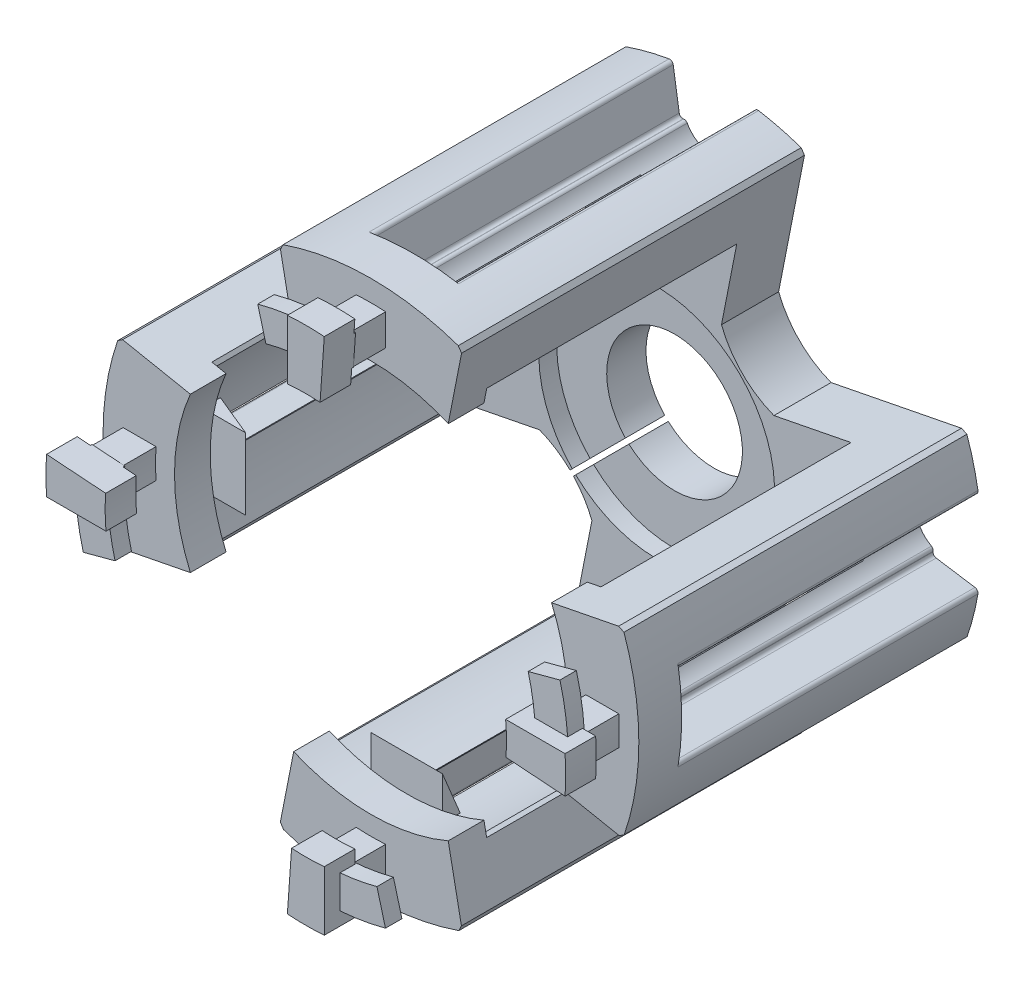
from build123d import *

# Parameters (mm, degrees)
SKETCH13_R                         = 1.7
CUT_EXTRUDE2_DEPTH                 = 72.529714105
CUT_EXTRUDE3_START                 = -6
SKETCH15_R                         = 3.25
CUT_EXTRUDE3_DEPTH                 = 66.529714105
CUT_EXTRUDE7_DEPTH                 = 72.529714105
SKETCH22_R                         = 9.5
CUT_EXTRUDE9_DEPTH                 = 8
CORTAR_EXTRUIR2_DEPTH              = 5
CHAFL_N1_SIZE                      = 0.424494443
CHAFL_N1_SIZE_2                    = 0.598474752
CHAFL_N1_SIZE_3                    = 0.5
SALIENTE_EXTRUIR4_START            = -4
SALIENTE_EXTRUIR4_DEPTH            = 6
CORTAR_EXTRUIR10_REACH             = 60.63
CORTAR_EXTRUIR10_DIRECTION_2_REACH = 60.63
CROQUIS29_R                        = 4.25
CORTAR_EXTRUIR11_DEPTH             = 42
REDONDEO2_R                        = 0.5
CORTAR_EXTRUIR14_REACH             = 73.53
CORTAR_EXTRUIR14_DIRECTION_2_REACH = 73.53
CORTAR_EXTRUIR15_REACH             = 73.53
CORTAR_EXTRUIR15_DIRECTION_2_REACH = 73.53
CORTAR_EXTRUIR17_DEPTH             = 2.523438
CORTAR_EXTRUIR17_DEPTH_BACK        = 2
CROQUIS40_R                        = 29
SCALE1_SCALE                       = 2.1714285
CUT_EXTRUDE10_DEPTH                = 23
SKETCH27_R                         = 4.590920363
SKETCH27_R_2                       = 4.507016233
SKETCH27_R_3                       = 5.572824569
SKETCH27_R_4                       = 4.546487361
BOSS_EXTRUDE1_DEPTH                = 13.028571
BOSS_EXTRUDE2_DEPTH                = 10
BOSS_EXTRUDE3_DEPTH                = 5
BOSS_EXTRUDE4_START                = -4.5
BOSS_EXTRUDE4_DEPTH                = 9.3
CUT_EXTRUDE12_START                = 10
SKETCH31_R                         = 89.186650453
CUT_EXTRUDE12_DEPTH                = 10
CUT_EXTRUDE15_DEPTH                = 10
CUT_EXTRUDE16_START                = -10
CUT_EXTRUDE16_DEPTH                = 10
CUT_EXTRUDE17_DEPTH                = 15
SKETCH35_R                         = 65.478901107
CUT_EXTRUDE18_DEPTH                = 0.5
CUT_EXTRUDE19_DEPTH                = 11
CIRPATTERN1_COUNT                  = 4
CUT_EXTRUDE20_DEPTH                = 11


with BuildPart() as part:
    # Sketch1 → Revolve1 (revolve)
    with BuildSketch(Plane(origin=(0, 0, 0), x_dir=(1, 0, 0), z_dir=(0, 1, 0))):
        Polygon((37.5, -48), (0, -48), (0, -45.5), (11.5, -45.5), (11.5, -43), (13, -43), (13, -45.5), (16.5, -45.5), (16.5, -43), (29, -43), (29, -8), (16.5, -8), (16.5, -5.5), (0, -5.5), (0, 0), (37.5, 0), align=None)
    revolve(axis=Axis((0, 0, 48), (0, 0, -1)))

    # Sketch13 → Cut-Extrude2 (cut, through all)
    with BuildSketch(Plane.XY.offset(48)):
        with Locations((0, -32.5)):
            Circle(SKETCH13_R)
        with Locations((-32.5, 0)):
            Circle(SKETCH13_R)
        with Locations((0, 32.5)):
            Circle(SKETCH13_R)
        with Locations((32.5, 0)):
            Circle(SKETCH13_R)
    cut_extrude2 = extrude(amount=-CUT_EXTRUDE2_DEPTH, mode=Mode.SUBTRACT)

    # Sketch15 → Cut-Extrude3 (cut, through all)
    with BuildSketch(Plane.XY.offset(48).offset(CUT_EXTRUDE3_START)):
        with Locations((32.5, 0)):
            Circle(SKETCH15_R)
        with Locations((0, 32.5)):
            Circle(SKETCH15_R)
        with Locations((-32.5, 0)):
            Circle(SKETCH15_R)
    cut_extrude3 = extrude(amount=-CUT_EXTRUDE3_DEPTH, mode=Mode.SUBTRACT)

    # Sketch19 → Cut-Extrude7 (cut, through all)
    with BuildSketch(Plane.XY):
        with BuildLine():
            Line((-35.254963314, 12.780358437), (-16.410016137, 9.07049449))
            ThreePointArc((-16.410016137, 9.07049449), (-11.965806565, 11.965806548), (-9.070494507, 16.41001612))
            Line((-9.070494507, 16.41001612), (-12.780358457, 35.254963298))
            ThreePointArc((-12.780358457, 35.254963298), (-26.516504301, 26.516504282), (-35.254963314, 12.780358437))
        make_face()
        with BuildLine():
            Line((12.780358458, 35.254963298), (9.070494508, 16.410016121))
            ThreePointArc((9.070494508, 16.410016121), (11.964662982, 11.964662966), (16.410016137, 9.07049449))
            Line((16.410016137, 9.07049449), (35.254963314, 12.780358437))
            ThreePointArc((35.254963314, 12.780358437), (26.516504301, 26.516504282), (12.780358458, 35.254963298))
        make_face()
    cut_extrude7 = extrude(amount=CUT_EXTRUDE7_DEPTH, mode=Mode.SUBTRACT)

    # Sketch22 → Cut-Extrude9 (cut)
    with BuildSketch(Plane.XY):
        Circle(SKETCH22_R)
    extrude(amount=CUT_EXTRUDE9_DEPTH, mode=Mode.SUBTRACT)

    # Simetría1: Cut-Extrude2, Cut-Extrude3, Cut-Extrude7 across plane
    add(cut_extrude2.mirror(Plane.ZX), mode=Mode.SUBTRACT)
    add(cut_extrude3.mirror(Plane.ZX), mode=Mode.SUBTRACT)
    add(cut_extrude7.mirror(Plane.ZX), mode=Mode.SUBTRACT)

    # Croquis2 → Cortar-Extruir2 (cut)
    with BuildSketch(Plane.XY.offset(48)):
        with BuildLine():
            ThreePointArc((27.500000001, 0), (0, 27.500000001), (-27.500000001, 0))
            ThreePointArc((-27.500000001, 0), (0, -27.500000001), (27.500000001, 0))
        make_face()
    extrude(amount=-CORTAR_EXTRUIR2_DEPTH, mode=Mode.SUBTRACT)

    # Chaflán1
    # the kernel refuses this chamfer: 0.598474752, 0.598474751, 0.5, 0.424494443 mm, written as the material it takes off along each edge
    with BuildSketch(Plane(origin=(26.786144822, 11.113165417, 43), x_dir=(0.9811682057533571, 0.19315525366589945, 0), z_dir=(0, 0, -1)), Plane(origin=(-26.786144822, -11.113165417, 43), x_dir=(-0.9811682057533575, -0.1931552536658979, 0), z_dir=(0, 0, -1)), Plane(origin=(11.113165438, -26.786144813, 43), x_dir=(0.19315525383159873, -0.9811682057207372, 0), z_dir=(0, 0, -1)), Plane(origin=(-11.113165438, 26.786144813, 43), x_dir=(-0.19315525383159932, 0.9811682057207369, 0), z_dir=(0, 0, -1))) as chafl_n1_piece_1:
        with BuildLine():
            Line((CHAFL_N1_SIZE, 0), (0.095359683, 0.495309657))
            ThreePointArc((0.095359683, 0.495309657), (0.050104646, 0.254453298), (0, 0))
            Line((0, 0), (CHAFL_N1_SIZE, 0))
        make_face()
    extrude(amount=35, mode=Mode.SUBTRACT)
    with BuildSketch(Plane(origin=(35.254963314, 12.780358437, -1.544879383), x_dir=(-0.9811682057533563, -0.19315525366590316, 0), z_dir=(0, 0, 1)), Plane(origin=(-35.254963314, -12.780358437, -1.544879383), x_dir=(0.9811682057533574, 0.19315525366589809, 0), z_dir=(0, 0, 1))) as chafl_n1_piece_2:
        with BuildLine():
            Line((CHAFL_N1_SIZE_2 * 0.999999998655, 0), (-0.072646196, 0.491380113))
            ThreePointArc((-0.072646196, 0.491380113), (-0.038365123, 0.253885272), (0, 0))
            Line((0, 0), (CHAFL_N1_SIZE_2 * 0.999999998655, 0))
        make_face()
    extrude(amount=51.089758766, mode=Mode.SUBTRACT)
    with BuildSketch(Plane(origin=(11.113165438, 26.786144813, 43), x_dir=(0.1931552538316015, 0.9811682057207366, 0), z_dir=(0, 0, -1)), Plane(origin=(-11.113165438, -26.786144813, 43), x_dir=(-0.19315525383160223, -0.9811682057207365, 0), z_dir=(0, 0, -1))) as chafl_n1_piece_3:
        with BuildLine():
            Line((CHAFL_N1_SIZE_3, 0), (0.081210474, -0.418789526))
            ThreePointArc((0.081210474, -0.418789526), (0.042440346, -0.214740554), (0, 0))
            Line((0, 0), (CHAFL_N1_SIZE_3, 0))
        make_face()
    extrude(amount=35, mode=Mode.SUBTRACT)
    with BuildSketch(Plane(origin=(12.780358458, 35.254963298, -1.528696863), x_dir=(-0.9427936694499047, 0.3333768090992289, 0), z_dir=(0, 0, 1)), Plane(origin=(-12.780358457, -35.254963298, -1.528696863), x_dir=(0.9427936694512155, -0.33337680909552225, 0), z_dir=(0, 0, 1))) as chafl_n1_piece_4:
        with BuildLine():
            Line((0.592108744, 0), (-CHAFL_N1_SIZE_3 * 0.144993175079, CHAFL_N1_SIZE_3 * 0.989432655202))
            Line((-CHAFL_N1_SIZE_3 * 0.144993175079, CHAFL_N1_SIZE_3 * 0.989432655202), (0, 0))
            ThreePointArc((0, 0), (0.305654294, -0.001167436), (0.592108744, 0))
        make_face()
    extrude(amount=51.057393726, mode=Mode.SUBTRACT)
    with BuildSketch(Plane(origin=(12.780358458, -35.254963298, -1.544879384), x_dir=(-0.19315525383160725, 0.9811682057207355, 0), z_dir=(0, 0, 1)), Plane(origin=(-12.780358457, 35.254963298, -1.544879384), x_dir=(0.19315525383159907, -0.9811682057207369, 0), z_dir=(0, 0, 1))) as chafl_n1_piece_5:
        with BuildLine():
            Line((CHAFL_N1_SIZE_2, 0), (-0.072646206, 0.491380121))
            ThreePointArc((-0.072646206, 0.491380121), (-0.038365133, 0.253885275), (0, 0))
            Line((0, 0), (CHAFL_N1_SIZE_2, 0))
        make_face()
    extrude(amount=51.089758768, mode=Mode.SUBTRACT)
    with BuildSketch(Plane(origin=(26.786144822, -11.113165417, 43), x_dir=(0.9811682057533571, -0.19315525366590003, 0), z_dir=(0, 0, -1)), Plane(origin=(-26.786144822, 11.113165417, 43), x_dir=(-0.9811682057533571, 0.19315525366590003, 0), z_dir=(0, 0, -1))) as chafl_n1_piece_6:
        with BuildLine():
            Line((CHAFL_N1_SIZE_3, 0), (0.081210473, -0.418789527))
            ThreePointArc((0.081210473, -0.418789527), (0.042440346, -0.214740554), (0, 0))
            Line((0, 0), (CHAFL_N1_SIZE_3, 0))
        make_face()
    extrude(amount=35, mode=Mode.SUBTRACT)
    with BuildSketch(Plane(origin=(35.254963314, -12.780358437, -1.528696832), x_dir=(0.33337679452852365, 0.9427936746021829, 0), z_dir=(0, 0, 1))) as chafl_n1_piece_7:
        with BuildLine():
            Line((0.592108732, 0), (-CHAFL_N1_SIZE_3 * 0.144993159955, CHAFL_N1_SIZE_3 * 0.989432657419))
            Line((-CHAFL_N1_SIZE_3 * 0.144993159955, CHAFL_N1_SIZE_3 * 0.989432657419), (0, 0))
            ThreePointArc((0, 0), (0.305654288, -0.001167431), (0.592108732, 0))
        make_face()
    extrude(amount=51.057393665, mode=Mode.SUBTRACT)
    with BuildSketch(Plane(origin=(-35.254963314, 12.780358437, -1.528696832), x_dir=(0.9811682057533581, -0.19315525366589525, 0), z_dir=(0, 0, 1))) as chafl_n1_piece_8:
        with BuildLine():
            Line((CHAFL_N1_SIZE_3, 0), (-0.085851716, -0.585851716))
            ThreePointArc((-0.085851716, -0.585851716), (-0.045472876, -0.302255064), (0, 0))
            Line((0, 0), (CHAFL_N1_SIZE_3, 0))
        make_face()
    extrude(amount=51.057393665, mode=Mode.SUBTRACT)

    # Croquis28 → Saliente-Extruir4 (add)
    with BuildSketch(Plane.XY.offset(41).offset(SALIENTE_EXTRUIR4_START)):
        Polygon((-5, 29.5), (-5, 22.5), (5, 22.5), (5, 29.5), (0, 29.5), align=None)
        Polygon((-5, -29.5), (-5, -22.5), (5, -22.5), (5, -29.5), (0, -29.5), align=None)
        Polygon((-29.5, 0), (-29.5, 5), (-22.500000001, 5), (-22.500000001, -5), (-29.5, -5), align=None)
        Polygon((29.5, 0), (29.5, 5), (22.5, 5), (22.5, -5), (29.5, -5), align=None)
    extrude(amount=SALIENTE_EXTRUIR4_DEPTH)

    # Cortar-Extruir10: up to this face of the body (flat: up to its plane)
    cortar_extruir10_end = Plane(part.part.faces().sort_by_distance((2.629134616, 30.747243589, 42))[0])
    # Croquis1 → Cortar-Extruir10 (cut, up to the picked face)
    with BuildSketch(Plane(origin=(0, 0, 25), x_dir=(-1, 0, 0), z_dir=(0, 0, -1)), mode=Mode.PRIVATE) as cortar_extruir10_sk1:
        with BuildLine():
            Line((4.769230769, 30.630939226), (5.769230769, 37.053555515))
            ThreePointArc((5.769230769, 37.053555515), (0, 37.5), (-5.769230769, 37.053555515))
            Line((-5.769230769, 37.053555515), (-4.769230769, 30.630939226))
            ThreePointArc((-4.769230769, 30.630939226), (0, 31), (4.769230769, 30.630939226))
        make_face()
    cortar_extruir10_tool1 = split(extrude(cortar_extruir10_sk1.sketch, amount=-CORTAR_EXTRUIR10_REACH, mode=Mode.PRIVATE), bisect_by=cortar_extruir10_end, keep=Keep.BOTH, mode=Mode.PRIVATE)
    # Croquis1 → Cortar-Extruir10 (cut, up to the picked face)
    with BuildSketch(Plane(origin=(0, 0, 25), x_dir=(-1, 0, 0), z_dir=(0, 0, -1)), mode=Mode.PRIVATE) as cortar_extruir10_sk2:
        with BuildLine():
            Line((-37.053555515, 5.769230769), (-30.630939226, 4.769230769))
            ThreePointArc((-30.630939226, 4.769230769), (-31, 0), (-30.630939226, -4.769230769))
            Line((-30.630939226, -4.769230769), (-37.053555515, -5.769230769))
            ThreePointArc((-37.053555515, -5.769230769), (-37.5, 0), (-37.053555515, 5.769230769))
        make_face()
    cortar_extruir10_tool2 = split(extrude(cortar_extruir10_sk2.sketch, amount=-CORTAR_EXTRUIR10_REACH, mode=Mode.PRIVATE), bisect_by=cortar_extruir10_end, keep=Keep.BOTH, mode=Mode.PRIVATE)
    # Croquis1 → Cortar-Extruir10 (cut, up to the picked face)
    with BuildSketch(Plane(origin=(0, 0, 25), x_dir=(-1, 0, 0), z_dir=(0, 0, -1)), mode=Mode.PRIVATE) as cortar_extruir10_sk3:
        with BuildLine():
            Line((-5.769230769, -37.053555515), (-4.769230769, -30.630939226))
            ThreePointArc((-4.769230769, -30.630939226), (0, -31), (4.769230769, -30.630939226))
            Line((4.769230769, -30.630939226), (5.769230769, -37.053555515))
            ThreePointArc((5.769230769, -37.053555515), (0, -37.5), (-5.769230769, -37.053555515))
        make_face()
    cortar_extruir10_tool3 = split(extrude(cortar_extruir10_sk3.sketch, amount=-CORTAR_EXTRUIR10_REACH, mode=Mode.PRIVATE), bisect_by=cortar_extruir10_end, keep=Keep.BOTH, mode=Mode.PRIVATE)
    # Croquis1 → Cortar-Extruir10 (cut, up to the picked face)
    with BuildSketch(Plane(origin=(0, 0, 25), x_dir=(-1, 0, 0), z_dir=(0, 0, -1)), mode=Mode.PRIVATE) as cortar_extruir10_sk4:
        with BuildLine():
            Line((30.630939226, -4.769230769), (37.053555515, -5.769230769))
            ThreePointArc((37.053555515, -5.769230769), (37.5, 0), (37.053555515, 5.769230769))
            Line((37.053555515, 5.769230769), (30.630939226, 4.769230769))
            ThreePointArc((30.630939226, 4.769230769), (31, 0), (30.630939226, -4.769230769))
        make_face()
    cortar_extruir10_tool4 = split(extrude(cortar_extruir10_sk4.sketch, amount=-CORTAR_EXTRUIR10_REACH, mode=Mode.PRIVATE), bisect_by=cortar_extruir10_end, keep=Keep.BOTH, mode=Mode.PRIVATE)
    add(cortar_extruir10_tool1.solids().sort_by(Axis((0, 34.216364, 25), (0, 0, 1)))[0], mode=Mode.SUBTRACT)
    add(cortar_extruir10_tool2.solids().sort_by(Axis((34.216364, 0, 25), (0, 0, 1)))[0], mode=Mode.SUBTRACT)
    add(cortar_extruir10_tool3.solids().sort_by(Axis((0, -34.216364, 25), (0, 0, 1)))[0], mode=Mode.SUBTRACT)
    add(cortar_extruir10_tool4.solids().sort_by(Axis((-34.216364, 0, 25), (0, 0, 1)))[0], mode=Mode.SUBTRACT)

    # Cortar-Extruir10 direction 2: up to this face of the body (flat: up to its plane)
    cortar_extruir10_direction_2_end = Plane(part.part.faces().sort_by_distance((-25.792069759, 9.836451612, 0))[0])
    # Croquis1 → Cortar-Extruir10 direction 2 (cut, up to the picked face)
    with BuildSketch(Plane(origin=(0, 0, 25), x_dir=(-1, 0, 0), z_dir=(0, 0, -1)), mode=Mode.PRIVATE) as cortar_extruir10_direction_2_sk1:
        with BuildLine():
            Line((4.769230769, 30.630939226), (5.769230769, 37.053555515))
            ThreePointArc((5.769230769, 37.053555515), (0, 37.5), (-5.769230769, 37.053555515))
            Line((-5.769230769, 37.053555515), (-4.769230769, 30.630939226))
            ThreePointArc((-4.769230769, 30.630939226), (0, 31), (4.769230769, 30.630939226))
        make_face()
    cortar_extruir10_direction_2_tool1 = split(extrude(cortar_extruir10_direction_2_sk1.sketch, amount=CORTAR_EXTRUIR10_DIRECTION_2_REACH, mode=Mode.PRIVATE), bisect_by=cortar_extruir10_direction_2_end, keep=Keep.BOTH, mode=Mode.PRIVATE)
    # Croquis1 → Cortar-Extruir10 direction 2 (cut, up to the picked face)
    with BuildSketch(Plane(origin=(0, 0, 25), x_dir=(-1, 0, 0), z_dir=(0, 0, -1)), mode=Mode.PRIVATE) as cortar_extruir10_direction_2_sk2:
        with BuildLine():
            Line((-37.053555515, 5.769230769), (-30.630939226, 4.769230769))
            ThreePointArc((-30.630939226, 4.769230769), (-31, 0), (-30.630939226, -4.769230769))
            Line((-30.630939226, -4.769230769), (-37.053555515, -5.769230769))
            ThreePointArc((-37.053555515, -5.769230769), (-37.5, 0), (-37.053555515, 5.769230769))
        make_face()
    cortar_extruir10_direction_2_tool2 = split(extrude(cortar_extruir10_direction_2_sk2.sketch, amount=CORTAR_EXTRUIR10_DIRECTION_2_REACH, mode=Mode.PRIVATE), bisect_by=cortar_extruir10_direction_2_end, keep=Keep.BOTH, mode=Mode.PRIVATE)
    # Croquis1 → Cortar-Extruir10 direction 2 (cut, up to the picked face)
    with BuildSketch(Plane(origin=(0, 0, 25), x_dir=(-1, 0, 0), z_dir=(0, 0, -1)), mode=Mode.PRIVATE) as cortar_extruir10_direction_2_sk3:
        with BuildLine():
            Line((-5.769230769, -37.053555515), (-4.769230769, -30.630939226))
            ThreePointArc((-4.769230769, -30.630939226), (0, -31), (4.769230769, -30.630939226))
            Line((4.769230769, -30.630939226), (5.769230769, -37.053555515))
            ThreePointArc((5.769230769, -37.053555515), (0, -37.5), (-5.769230769, -37.053555515))
        make_face()
    cortar_extruir10_direction_2_tool3 = split(extrude(cortar_extruir10_direction_2_sk3.sketch, amount=CORTAR_EXTRUIR10_DIRECTION_2_REACH, mode=Mode.PRIVATE), bisect_by=cortar_extruir10_direction_2_end, keep=Keep.BOTH, mode=Mode.PRIVATE)
    # Croquis1 → Cortar-Extruir10 direction 2 (cut, up to the picked face)
    with BuildSketch(Plane(origin=(0, 0, 25), x_dir=(-1, 0, 0), z_dir=(0, 0, -1)), mode=Mode.PRIVATE) as cortar_extruir10_direction_2_sk4:
        with BuildLine():
            Line((30.630939226, -4.769230769), (37.053555515, -5.769230769))
            ThreePointArc((37.053555515, -5.769230769), (37.5, 0), (37.053555515, 5.769230769))
            Line((37.053555515, 5.769230769), (30.630939226, 4.769230769))
            ThreePointArc((30.630939226, 4.769230769), (31, 0), (30.630939226, -4.769230769))
        make_face()
    cortar_extruir10_direction_2_tool4 = split(extrude(cortar_extruir10_direction_2_sk4.sketch, amount=CORTAR_EXTRUIR10_DIRECTION_2_REACH, mode=Mode.PRIVATE), bisect_by=cortar_extruir10_direction_2_end, keep=Keep.BOTH, mode=Mode.PRIVATE)
    add(cortar_extruir10_direction_2_tool1.solids().sort_by(Axis((0, 34.216364, 25), (0, 0, -1)))[0], mode=Mode.SUBTRACT)
    add(cortar_extruir10_direction_2_tool2.solids().sort_by(Axis((34.216364, 0, 25), (0, 0, -1)))[0], mode=Mode.SUBTRACT)
    add(cortar_extruir10_direction_2_tool3.solids().sort_by(Axis((0, -34.216364, 25), (0, 0, -1)))[0], mode=Mode.SUBTRACT)
    add(cortar_extruir10_direction_2_tool4.solids().sort_by(Axis((-34.216364, 0, 25), (0, 0, -1)))[0], mode=Mode.SUBTRACT)

    # Croquis29 → Cortar-Extruir11 (cut)
    with BuildSketch(Plane.XY):
        with Locations((0, -32.5)):
            Circle(CROQUIS29_R)
        with Locations((0, 32.5)):
            Circle(CROQUIS29_R)
        with Locations((32.5, 0)):
            Circle(CROQUIS29_R)
        with Locations((-32.5, 0)):
            Circle(CROQUIS29_R)
    extrude(amount=CORTAR_EXTRUIR11_DEPTH, mode=Mode.SUBTRACT)

    # Redondeo2
    redondeo2_edges = [part.edges().sort_by_distance(p)[0] for p in [
        (-4.769230769, 30.630939226, 21),
        (4.769230769, 30.630939226, 21),
        (-5.769230769, 37.053555515, 21),
        (5.769230769, 37.053555515, 21),
        (30.630939226, 4.769230769, 21),
        (30.630939226, -4.769230769, 21),
        (37.053555515, 5.769230769, 21),
        (37.053555515, -5.769230769, 21),
        (-4.769230769, -30.630939226, 21),
        (4.769230769, -30.630939226, 21),
        (5.769230769, -37.053555515, 21),
        (-5.769230769, -37.053555515, 21),
        (-30.630939226, -4.769230769, 21),
        (-37.053555515, -5.769230769, 21),
        (-37.053555515, 5.769230769, 21),
        (-30.630939226, 4.769230769, 21),
        (-30.756730769, -3.876017594, 21),
        (-3.876017594, 30.756730769, 21),
        (30.756730769, 3.876017594, 21),
        (3.876017594, -30.756730769, 21),
        (-3.876017594, -30.756730769, 21),
        (3.876017594, 30.756730769, 21),
        (30.756730769, -3.876017594, 21),
        (-30.756730769, 3.876017594, 21),
    ]]
    fillet(redondeo2_edges, radius=REDONDEO2_R)

    # Cortar-Extruir14: up to this face of the body (flat: up to its plane)
    cortar_extruir14_end = Plane(part.part.faces().sort_by_distance((-25.532856857, -5, 40))[0])
    # Croquis35 → Cortar-Extruir14 (cut, up to the picked face)
    with BuildSketch(Plane(origin=(0, 0, 0), x_dir=(1, 0, 0), z_dir=(0, 1, 0)), mode=Mode.PRIVATE) as cortar_extruir14_sk1:
        Polygon((-28.525380373, -37), (-22.500000001, -37), (-22.500000001, -43.019491245), (-28.525380373, -40.52), align=None)
    cortar_extruir14_tool1 = split(extrude(cortar_extruir14_sk1.sketch, amount=-CORTAR_EXTRUIR14_REACH, mode=Mode.PRIVATE), bisect_by=cortar_extruir14_end, keep=Keep.BOTH, mode=Mode.PRIVATE)
    cortar_extruir14 = cortar_extruir14_tool1.solids().sort_by(Axis((-25.249567, 0, 39.439448), (0, -1, 0)))[0]
    add(cortar_extruir14, mode=Mode.SUBTRACT)

    # Cortar-Extruir14 direction 2: up to this face of the body (flat: up to its plane)
    cortar_extruir14_direction_2_end = Plane(part.part.faces().sort_by_distance((-25.532856857, 5, 40))[0])
    # Croquis35 → Cortar-Extruir14 direction 2 (cut, up to the picked face)
    with BuildSketch(Plane(origin=(0, 0, 0), x_dir=(1, 0, 0), z_dir=(0, 1, 0)), mode=Mode.PRIVATE) as cortar_extruir14_direction_2_sk1:
        Polygon((-28.525380373, -37), (-22.500000001, -37), (-22.500000001, -43.019491245), (-28.525380373, -40.52), align=None)
    cortar_extruir14_direction_2_tool1 = split(extrude(cortar_extruir14_direction_2_sk1.sketch, amount=CORTAR_EXTRUIR14_DIRECTION_2_REACH, mode=Mode.PRIVATE), bisect_by=cortar_extruir14_direction_2_end, keep=Keep.BOTH, mode=Mode.PRIVATE)
    cortar_extruir14_direction_2 = cortar_extruir14_direction_2_tool1.solids().sort_by(Axis((-25.249567, 0, 39.439448), (0, 1, 0)))[0]
    add(cortar_extruir14_direction_2, mode=Mode.SUBTRACT)

    # Simetría2: Cortar-Extruir14, Cortar-Extruir14 direction 2 across plane
    add(cortar_extruir14.mirror(Plane(origin=(0, 0, 0), x_dir=(0, 0, 1), z_dir=(1, 0, 0))), mode=Mode.SUBTRACT)
    add(cortar_extruir14_direction_2.mirror(Plane(origin=(0, 0, 0), x_dir=(0, 0, 1), z_dir=(1, 0, 0))), mode=Mode.SUBTRACT)

    # Cortar-Extruir15: up to this face of the body (flat: up to its plane)
    cortar_extruir15_end = Plane(part.part.faces().sort_by_distance((5, -25.532856857, 40))[0])
    # Croquis37 → Cortar-Extruir15 (cut, up to the picked face)
    with BuildSketch(Plane(origin=(0, 0, 0), x_dir=(0, 0, -1), z_dir=(1, 0, 0)), mode=Mode.PRIVATE) as cortar_extruir15_sk1:
        Polygon((-40.523437886, -28.525380365), (-43.023437886, -22.499993195), (-35.023437886, -22.499993195), (-35.023437886, -28.525380365), align=None)
    cortar_extruir15_tool1 = split(extrude(cortar_extruir15_sk1.sketch, amount=CORTAR_EXTRUIR15_REACH, mode=Mode.PRIVATE), bisect_by=cortar_extruir15_end, keep=Keep.BOTH, mode=Mode.PRIVATE)
    cortar_extruir15 = cortar_extruir15_tool1.solids().sort_by(Axis((0, -25.326718, 38.437018), (1, 0, 0)))[0]
    add(cortar_extruir15, mode=Mode.SUBTRACT)

    # Cortar-Extruir15 direction 2: up to this face of the body (flat: up to its plane)
    cortar_extruir15_direction_2_end = Plane(part.part.faces().sort_by_distance((-5, -25.532856857, 40))[0])
    # Croquis37 → Cortar-Extruir15 direction 2 (cut, up to the picked face)
    with BuildSketch(Plane(origin=(0, 0, 0), x_dir=(0, 0, -1), z_dir=(1, 0, 0)), mode=Mode.PRIVATE) as cortar_extruir15_direction_2_sk1:
        Polygon((-40.523437886, -28.525380365), (-43.023437886, -22.499993195), (-35.023437886, -22.499993195), (-35.023437886, -28.525380365), align=None)
    cortar_extruir15_direction_2_tool1 = split(extrude(cortar_extruir15_direction_2_sk1.sketch, amount=-CORTAR_EXTRUIR15_DIRECTION_2_REACH, mode=Mode.PRIVATE), bisect_by=cortar_extruir15_direction_2_end, keep=Keep.BOTH, mode=Mode.PRIVATE)
    cortar_extruir15_direction_2 = cortar_extruir15_direction_2_tool1.solids().sort_by(Axis((0, -25.326718, 38.437018), (-1, 0, 0)))[0]
    add(cortar_extruir15_direction_2, mode=Mode.SUBTRACT)

    # Simetría3: Cortar-Extruir15, Cortar-Extruir15 direction 2 across plane
    add(cortar_extruir15.mirror(Plane.ZX), mode=Mode.SUBTRACT)
    add(cortar_extruir15_direction_2.mirror(Plane.ZX), mode=Mode.SUBTRACT)

    # Croquis40 → Cortar-Extruir17 (cut, two sides: drawn at the far end of the back side and taken through both)
    with BuildSketch(Plane.XY.offset(38).offset(-CORTAR_EXTRUIR17_DEPTH_BACK)):
        Circle(CROQUIS40_R)
    extrude(amount=CORTAR_EXTRUIR17_DEPTH + CORTAR_EXTRUIR17_DEPTH_BACK, mode=Mode.SUBTRACT)


with BuildPart() as part_1:
    # Scale1: scaled about (-5.8101e-05, 0, 19.382301169)
    add(part.part.scale(SCALE1_SCALE).moved(Location((6.8061e-05, 0, -22.704979985))))

    # Sketch26 → Cut-Extrude10 (cut)
    with BuildSketch(Plane(origin=(0, 0, -22.704980025), x_dir=(-1, 0, 0), z_dir=(0, 0, -1))):
        Polygon((-0.707106781, -0.707106781), (0.353553391, 0.353553391), (43.744234901, -43.03712812), (42.68357473, -44.097788292), align=None)
    extrude(amount=-CUT_EXTRUDE10_DEPTH, mode=Mode.SUBTRACT)

    # Sketch27 → Boss-Extrude1 (add)
    with BuildSketch(Plane(origin=(0, 0, 68.495016975), x_dir=(-1, 0, 0), z_dir=(0, 0, -1))):
        with Locations((-70.57149431, 0)):
            Circle(SKETCH27_R)
        with Locations((0, -70.503096302)):
            Circle(SKETCH27_R_2)
        with Locations((70.57135819, 0)):
            Circle(SKETCH27_R_3)
        with Locations((-6.806e-05, 70.57142625)):
            Circle(SKETCH27_R_4)
    extrude(amount=-BOSS_EXTRUDE1_DEPTH)

    # Boss-Extrude2: read off the stored shape, not the designer's step
    # Boss-Extrude2 outline → Boss-Extrude2 (add)
    with BuildSketch(Plane.XY.offset(81.523587975)):
        with BuildLine():
            Line((-4.468777106, 75.346496558), (-4.468777106, 65.326231496))
            ThreePointArc((-4.468777106, 65.326231496), (0, 65.478901107), (4.468777106, 65.326231496))
            Line((4.468777106, 65.326231496), (4.468777106, 75.346496558))
            ThreePointArc((4.468777106, 75.346496558), (0, 75.478901107), (-4.468777106, 75.346496558))
        make_face()
    boss_extrude2 = extrude(amount=BOSS_EXTRUDE2_DEPTH)

    # Sketch29 → Boss-Extrude3 (add)
    with BuildSketch(Plane.XY.offset(91.523587975)):
        with BuildLine():
            ThreePointArc((-16.823237932, 62.785178709), (-8.484202494, 64.443915989), (0, 65))
            Line((0, 65), (0, 65.478901107))
            ThreePointArc((0, 65.478901107), (-2.235692109, 65.440722574), (-4.468777106, 65.326231496))
            Line((-4.468777106, 65.326231496), (-4.468777106, 74.866748501))
            ThreePointArc((-4.468777106, 74.866748501), (-12.001372914, 74.033553529), (-19.411428383, 72.444436972))
            Line((-19.411428383, 72.444436972), (-16.823237932, 62.785178709))
        make_face()
        with BuildLine():
            ThreePointArc((-4.468777106, 65.326231496), (-2.235692109, 65.440722574), (0, 65.478901107))
            Line((0, 65.478901107), (0, 75))
            ThreePointArc((0, 75), (-2.235381667, 74.966679724), (-4.468777106, 74.866748501))
            Line((-4.468777106, 74.866748501), (-4.468777106, 65.326231496))
        make_face()
        with BuildLine():
            Line((0, 75), (0, 65.478901107))
            ThreePointArc((0, 65.478901107), (2.235692109, 65.440722574), (4.468777106, 65.326231496))
            Line((4.468777106, 65.326231496), (4.468777106, 74.866748501))
            ThreePointArc((4.468777106, 74.866748501), (2.235381667, 74.966679724), (0, 75))
        make_face()
        with BuildLine():
            Line((0, 65.478901107), (0, 65))
            ThreePointArc((0, 65), (8.484202494, 64.443915989), (16.823237932, 62.785178709))
            Line((16.823237932, 62.785178709), (19.411428383, 72.444436972))
            ThreePointArc((19.411428383, 72.444436972), (12.001372914, 74.033553529), (4.468777106, 74.866748501))
            Line((4.468777106, 74.866748501), (4.468777106, 65.326231496))
            ThreePointArc((4.468777106, 65.326231496), (2.235692109, 65.440722574), (0, 65.478901107))
        make_face()
    boss_extrude3 = extrude(amount=BOSS_EXTRUDE3_DEPTH)

    # Sketch30 → Boss-Extrude4 (add)
    with BuildSketch(Plane.XY.offset(96.523587975).offset(BOSS_EXTRUDE4_START)):
        with BuildLine():
            Line((5.605534648, 81.235402092), (6.806e-05, 81.235402092))
            Line((6.806e-05, 81.235402092), (-5.605398527, 81.235402092))
            Line((-5.605398527, 81.235402092), (-5.605398527, 74.790236711))
            ThreePointArc((-5.605398527, 74.790236711), (6.8251e-05, 75), (5.605534648, 74.790226509))
            Line((5.605534648, 74.790226509), (5.605534648, 81.235402092))
        make_face()
        with BuildLine():
            Line((5.605534648, 64.75784108), (5.605534648, 74.790226509))
            ThreePointArc((5.605534648, 74.790226509), (6.8251e-05, 75), (-5.605398527, 74.790236711))
            Line((-5.605398527, 74.790236711), (-5.605398527, 64.757852862))
            ThreePointArc((-5.605398527, 64.757852862), (6.8315e-05, 65), (5.605534648, 64.75784108))
        make_face()
        with BuildLine():
            Line((5.605534648, 59.745368375), (5.605534648, 64.75784108))
            ThreePointArc((5.605534648, 64.75784108), (6.8315e-05, 65), (-5.605398527, 64.757852862))
            Line((-5.605398527, 64.757852862), (-5.605398527, 59.745368375))
            Line((-5.605398527, 59.745368375), (6.806e-05, 59.745368375))
            Line((6.806e-05, 59.745368375), (5.605534648, 59.745368375))
        make_face()
    boss_extrude4 = extrude(amount=BOSS_EXTRUDE4_DEPTH)

    # Sketch31 → Cut-Extrude12 (cut)
    # profile 1 of 2: a face of its own
    with BuildSketch(Plane(origin=(0, 0, 91.523587975), x_dir=(-1, 0, 0), z_dir=(0, 0, -1)).offset(CUT_EXTRUDE12_START)):
        Circle(SKETCH31_R)
        with BuildLine():
            ThreePointArc((19.411428383, 72.444436972), (59.501500522, 45.657107176), (75, 0))
            ThreePointArc((75, 0), (-45.657107176, -59.501500522), (-19.411428383, 72.444436972))
            ThreePointArc((-19.411428383, 72.444436972), (-12.001372914, 74.033553529), (-4.468777106, 74.866748501))
            ThreePointArc((-4.468777106, 74.866748501), (0, 75), (4.468777106, 74.866748501))
            ThreePointArc((4.468777106, 74.866748501), (12.001372914, 74.033553529), (19.411428383, 72.444436972))
        make_face(mode=Mode.SUBTRACT)
    # profile 2 of 2: a face of its own
    with BuildSketch(Plane(origin=(0, 0, 91.523587975), x_dir=(-1, 0, 0), z_dir=(0, 0, -1)).offset(CUT_EXTRUDE12_START)):
        with BuildLine():
            ThreePointArc((-16.823237932, 62.785178709), (-39.569492886, -51.567967119), (65, 0))
            ThreePointArc((65, 0), (51.567967119, 39.569492886), (16.823237932, 62.785178709))
            ThreePointArc((16.823237932, 62.785178709), (0, 65), (-16.823237932, 62.785178709))
        make_face()
    extrude(amount=-CUT_EXTRUDE12_DEPTH, mode=Mode.SUBTRACT)

    # Sketch32 → Cut-Extrude15 (cut)
    with BuildSketch(Plane.XY.offset(101.323587975)):
        with BuildLine():
            ThreePointArc((-5.605398527, 78.800880353), (6.806e-05, 79), (5.605534648, 78.800880353))
            Line((5.605534648, 78.800880353), (5.605534648, 81.235402092))
            Line((5.605534648, 81.235402092), (-5.605398527, 81.235402092))
            Line((-5.605398527, 81.235402092), (-5.605398527, 78.800880353))
        make_face()
        with BuildLine():
            Line((5.605534648, 59.745368375), (5.605534648, 60.741902706))
            ThreePointArc((5.605534648, 60.741902706), (6.806e-05, 61), (-5.605398527, 60.741902706))
            Line((-5.605398527, 60.741902706), (-5.605398527, 59.745368375))
            Line((-5.605398527, 59.745368375), (5.605534648, 59.745368375))
        make_face()
    cut_extrude15 = extrude(amount=-CUT_EXTRUDE15_DEPTH, mode=Mode.SUBTRACT)

    # Sketch33 → Cut-Extrude16 (cut)
    with BuildSketch(Plane.XY.offset(96.523587975).offset(CUT_EXTRUDE16_START)):
        with BuildLine():
            Line((5.605534648, 74.790226509), (5.605534648, 64.75784108))
            ThreePointArc((5.605534648, 64.75784108), (11.257677783, 64.017690453), (16.823237932, 62.785178709))
            Line((16.823237932, 62.785178709), (19.411428383, 72.444436972))
            ThreePointArc((19.411428383, 72.444436972), (12.563351144, 73.940261076), (5.605534648, 74.790226509))
        make_face()
    extrude(amount=CUT_EXTRUDE16_DEPTH, mode=Mode.SUBTRACT)

    # Sketch34 → Cut-Extrude17 (cut)
    with BuildSketch(Plane.XY.offset(101.323587975)):
        with BuildLine():
            Line((4.3283243, 60.846250484), (5.605534648, 78.800880353))
            Line((5.605534648, 78.800880353), (5.605534648, 60.741902706))
            ThreePointArc((5.605534648, 60.741902706), (4.967203494, 60.797430584), (4.3283243, 60.846250484))
        make_face()
    cut_extrude17 = extrude(amount=-CUT_EXTRUDE17_DEPTH, mode=Mode.SUBTRACT)

    # Sketch35 → Cut-Extrude18 (cut)
    with BuildSketch(Plane(origin=(0, 0, 91.523587975), x_dir=(-1, 0, 0), z_dir=(0, 0, -1))):
        Circle(SKETCH35_R)
    extrude(amount=-CUT_EXTRUDE18_DEPTH, mode=Mode.SUBTRACT)

    # Sketch36 → Cut-Extrude19 (cut)
    with BuildSketch(Plane(origin=(0, 0, 92.023587975), x_dir=(-1, 0, 0), z_dir=(0, 0, -1))):
        with BuildLine():
            Line((15.722420657, 58.67687271), (16.947186659, 63.247761657))
            ThreePointArc((16.947186659, 63.247761657), (11.320139833, 64.492952517), (5.605398527, 65.238531541))
            Line((5.605398527, 65.238531541), (5.605398527, 60.741902706))
            Line((5.605398527, 60.741902706), (15.722420657, 58.67687271))
        make_face()
    extrude(amount=-CUT_EXTRUDE19_DEPTH, mode=Mode.SUBTRACT)

    # CirPattern1: Boss-Extrude2, Boss-Extrude3, Boss-Extrude4, Cut-Extrude15, Cut-Extrude17 ×4 about axis
    cirpattern1_axis = Axis((0, 0, 0), (0, 0, 1))
    add([boss_extrude2.rotate(cirpattern1_axis, i * 360 / CIRPATTERN1_COUNT) for i in range(1, CIRPATTERN1_COUNT)])
    add([boss_extrude3.rotate(cirpattern1_axis, i * 360 / CIRPATTERN1_COUNT) for i in range(1, CIRPATTERN1_COUNT)])
    add([boss_extrude4.rotate(cirpattern1_axis, i * 360 / CIRPATTERN1_COUNT) for i in range(1, CIRPATTERN1_COUNT)])
    add([cut_extrude15.rotate(cirpattern1_axis, i * 360 / CIRPATTERN1_COUNT) for i in range(1, CIRPATTERN1_COUNT)], mode=Mode.SUBTRACT)
    add([cut_extrude17.rotate(cirpattern1_axis, i * 360 / CIRPATTERN1_COUNT) for i in range(1, CIRPATTERN1_COUNT)], mode=Mode.SUBTRACT)

    # Sketch37 → Cut-Extrude20 (cut)
    with BuildSketch(Plane.XY.offset(101.323587975)):
        Polygon((74.764695253, -5.468156072), (46.840766257, -4.752917648), (48.914862682, -17.612315484), (80.441128344, -22.866693094), (75.187201504, -5.468156072), align=None)
        Polygon((-5.52178509, -74.954375931), (-5.168922261, -61.178107414), (-17.992703796, -61.178107414), (-22.975404395, -78.120032476), align=None)
        Polygon((-74.824165462, 5.468413372), (-60.339742382, 5.468413372), (-59.957444183, 20.393880752), (-77.556528739, 21.226134997), align=None)
    extrude(amount=-CUT_EXTRUDE20_DEPTH, mode=Mode.SUBTRACT)


solid = part_1.part
